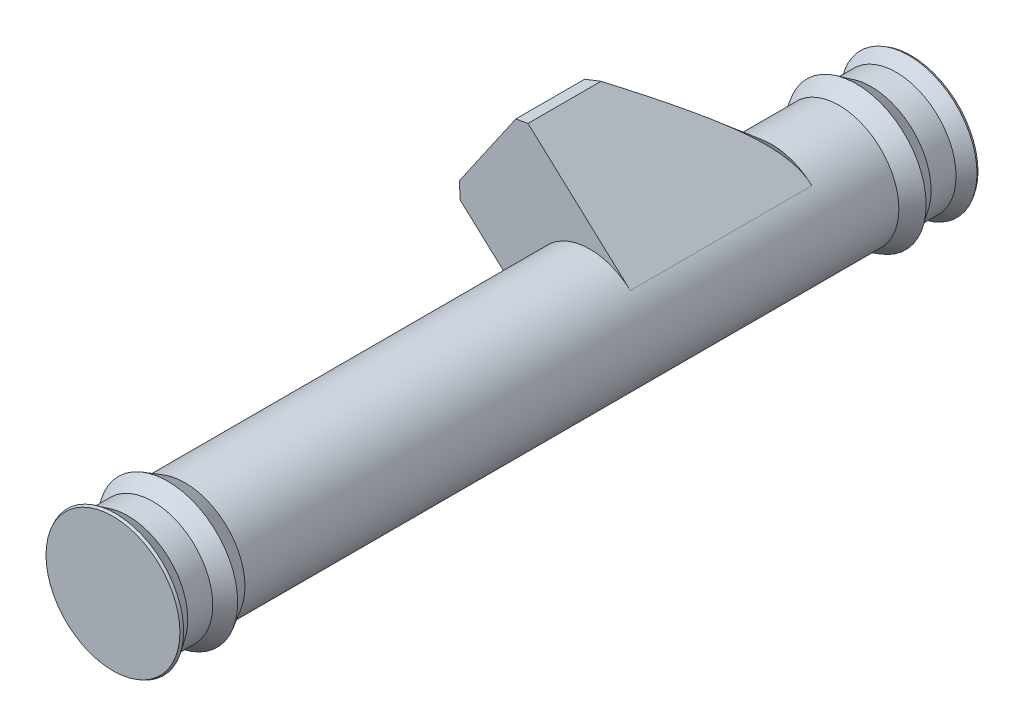
from build123d import *
from OCP.BRepFilletAPI import BRepFilletAPI_MakeChamfer

# Parameters (mm, degrees)
BOSS_EXTRUDE1_DEPTH      = 3
SKETCH4_R                = 6
BOSS_EXTRUDE2_DEPTH      = 40
BOSS_EXTRUDE3_DEPTH      = 4.7
BOSS_EXTRUDE3_DEPTH_BACK = 1.5
CHAMFER1_START           = -13.500000159
CHAMFER1_DEPTH           = 12.000000159
CHAMFER1_2_ANGLE         = 180
CUT_EXTRUDE1_DEPTH       = 3.4
SKETCH9_R                = 1.4
CUT_EXTRUDE2_DEPTH       = 27.5
SKETCH10_R               = 3.5
CUT_EXTRUDE3_DEPTH       = 23
CHAMFER2_SIZE            = 3
CHAMFER2_SIZE_2          = 2.517298894
CHAMFER3_SIZE            = 1
CHAMFER3_SIZE2           = 1.169832114
CHAMFER3_SIZE2_2         = 0.887609284
CHAMFER4_SIZE            = 1.732050808
CHAMFER4_SIZE_2          = 1
CHAMFER5_SIZE            = 0.3
CHAMFER5_SIZE2           = 0.289831366


with BuildPart() as part:
    # Sketch3 → Boss-Extrude1 (new body)
    with BuildSketch(Plane.XY):
        with BuildLine():
            ThreePointArc((-21.06925633, 1.560185503), (-21.702383426, -4.120337722), (-16.861546239, -7.159332517))
            Line((-16.861546239, -7.159332517), (-16.235942246, -7.122800897))
            ThreePointArc((-16.235942246, -7.122800897), (-14.247317716, -6.480760333), (-12.653836147, -5.128850538))
            ThreePointArc((-12.653836147, -5.128850538), (21.262556938, 11.81913919), (56.062735888, -3.230898045))
            ThreePointArc((56.062735888, -3.230898045), (59.548283557, -3.823314658), (60.140700171, -0.337766989))
            ThreePointArc((60.140700171, -0.337766989), (19.96998669, 19.192613792), (-21.06925633, 1.560185503))
        make_face()
        Polygon((-14.842971244, -1.436629161), (-14.495267888, -1.784332517), (-14.848821278, -2.137885908), (-14.637840313, -2.550832882), (-15.083092963, -2.778319315), (-15.00954079, -3.236171091), (-15.503211236, -3.315477399), (-15.574237606, -3.773727796), (-16.068337858, -3.697144889), (-16.277038544, -4.111248976), (-16.723538831, -3.886221213), (-17.049626765, -4.215925369), (-17.405124343, -3.864326917), (-17.816901648, -4.077581746), (-18.046839834, -3.633590269), (-18.504279068, -3.70966601), (-18.586306367, -3.21644038), (-19.04494145, -3.147941973), (-18.971084274, -2.65342694), (-19.386332882, -2.447012878), (-19.163770631, -1.999278532), (-19.495267888, -1.67501361), (-19.145635065, -1.317582653), (-19.361157273, -0.906987537), (-18.918440472, -0.674604591), (-18.997037466, -0.217591808), (-18.504271649, -0.132846012), (-18.438303288, 0.326159812), (-17.94338851, 0.255030612), (-17.73926735, 0.671411115), (-17.290312559, 0.451321143), (-16.967880508, 0.784601421), (-16.60852704, 0.436944858), (-16.199126599, 0.654727893), (-15.964305958, 0.213299227), (-15.507733522, 0.294415085), (-15.420271807, -0.197875935), (-14.960909199, -0.261312244), (-15.029308259, -0.756611718), (-14.611808522, -0.958433771), align=None, mode=Mode.SUBTRACT)
    extrude(amount=BOSS_EXTRUDE1_DEPTH)


with BuildPart() as body_2:
    # Sketch4 → Boss-Extrude2 (new, symmetric)
    with BuildSketch(Plane.XY.offset(12.5)):
        with Locations((58.101718029, -1.784332517)):
            Circle(SKETCH4_R)
    extrude(amount=BOSS_EXTRUDE2_DEPTH, both=True)

    # Sketch8 → Boss-Extrude3 (add, two sides: drawn at the far end of the back side and taken through both)
    with BuildSketch(Plane.XY.offset(-BOSS_EXTRUDE3_DEPTH_BACK)):
        with BuildLine():
            Line((62.151425867, 2.642841122), (51.244940369, 12.619427404))
            Line((51.244940369, 12.619427404), (44.360090975, 2.654069132))
            Line((44.360090975, 2.654069132), (54.052010192, -6.211506156))
            ThreePointArc((54.052010192, -6.211506156), (62.528891669, -5.834040354), (62.151425867, 2.642841122))
        make_face()
    extrude(amount=BOSS_EXTRUDE3_DEPTH + BOSS_EXTRUDE3_DEPTH_BACK)

    # Chamfer1: read off the stored shape, not the designer's step
    # Chamfer1 outline → Chamfer1 (add)
    with BuildSketch(Plane.XY.offset(CHAMFER1_START)):
        with BuildLine():
            Line((51.244940369, 12.619427404), (44.360090975, 2.654069132))
            Line((44.360090975, 2.654069132), (54.052010192, -6.211506156))
            ThreePointArc((54.052010192, -6.211506156), (53.67454439, 2.265375321), (62.151425867, 2.642841122))
            Line((62.151425867, 2.642841122), (51.244940369, 12.619427404))
        make_face()
    extrude(amount=CHAMFER1_DEPTH)

    # Chamfer1 2 outline → Chamfer1 2 (revolve, cut)
    with BuildSketch(Plane(origin=(58.101718029, -1.784332517, 0), x_dir=(0.6749513062060508, 0.7378622732263427, 0), z_dir=(0.7378622732263427, -0.6749513062060508, 0))):
        Polygon((15.952545244, -1.63901845), (5.999993338, -13.500007939), (15.952545243, -13.500000159), align=None)
    revolve(axis=Axis((58.101718029, -1.784332517, 0), (0, 0, 1)), revolution_arc=CHAMFER1_2_ANGLE, mode=Mode.SUBTRACT)

    # Sketch6 → Cut-Extrude1 (cut)
    with BuildSketch(Plane.XY):
        with BuildLine():
            Line((-16.85267585, -7.459325585), (-16.209835721, -7.421787475))
            ThreePointArc((-16.209835721, -7.421787475), (-14.1052834, -6.74504216), (-12.418987212, -5.315521311))
            ThreePointArc((-12.418987212, -5.315521311), (21.262849062, 11.519032134), (55.827922983, -3.418301943))
            ThreePointArc((55.827922983, -3.418301943), (59.733301775, -4.059840039), (60.378935523, -0.155136246))
            ThreePointArc((60.378935523, -0.155136246), (19.977496019, 19.492520208), (-21.298028536, 1.754487883))
            ThreePointArc((-21.298028536, 1.754487883), (-21.97276199, -4.250320867), (-16.85267585, -7.459325585))
        make_face()
    extrude(amount=CUT_EXTRUDE1_DEPTH, mode=Mode.SUBTRACT)

    # Sketch9 → Cut-Extrude2 (cut)
    with BuildSketch(Plane(origin=(0, 0, -27.5), x_dir=(-1, 0, 0), z_dir=(0, 0, -1))):
        with Locations((-58.101718029, -1.784332517)):
            Circle(SKETCH9_R)
    extrude(amount=-CUT_EXTRUDE2_DEPTH, mode=Mode.SUBTRACT)

    # Sketch10 → Cut-Extrude3 (cut)
    with BuildSketch(Plane(origin=(0, 0, -27.5), x_dir=(-1, 0, 0), z_dir=(0, 0, -1))):
        with Locations((-58.101718029, -1.784332517)):
            Circle(SKETCH10_R)
    extrude(amount=-CUT_EXTRUDE3_DEPTH, mode=Mode.SUBTRACT)

    # Chamfer2
    # the kernel refuses this chamfer: 3, 2.517298894 mm, written as the material it adds along each edge
    with BuildSketch(Plane(origin=(58.101718029, -1.784332517, -4.5), x_dir=(-1, 0, 0), z_dir=(0, -1, 0))) as chamfer2_piece_1_section:
        Polygon((3.5, CHAMFER2_SIZE), (3.5 - CHAMFER2_SIZE_2, 0), (3.5, 0), align=None)
    chamfer2_piece_1 = revolve(axis=Axis((58.101718029, -1.784332517, -4.5), (0, 0, -1)), mode=Mode.PRIVATE)
    chamfer2_piece_1 = chamfer2_piece_1 - Plane(origin=(58.101718029, -1.784332517, -4.5), x_dir=(-1, 0, 0), z_dir=(0, 0, -1)) * Cylinder(1.4, 14, mode=Mode.PRIVATE)
    add(chamfer2_piece_1)

    # Sketch11 → Revolve1 (revolve)
    with BuildSketch(Plane(origin=(58.101718029, 0, 0), x_dir=(0, 0, -1), z_dir=(1, 0, 0)), mode=Mode.PRIVATE) as revolve1_sk:
        Polygon((27.5, -7.784332517), (27.5, -8.784332517), (26, -7.784332517), align=None)
        Polygon((23.5, -7.784332517), (22, -8.784332517), (22, -7.784332517), align=None)
    revolve1 = revolve(revolve1_sk.sketch.rotate(Axis((58.101718029, -1.784332517, 52.5), (0, 0, -1)), 270), axis=Axis((58.101718029, -1.784332517, 52.5), (0, 0, -1)))

    # Mirror1: Revolve1 across plane
    add(revolve1.mirror(Plane.XY.offset(12.5)))

    # Chamfer3: one chamfer whose edges measure the first distance from different faces: ONE call of the kernel's chamfer builder (chamfer() names one face for all edges)
    chamfer3_edges_1 = [body_2.edges().sort_by_distance(p)[0] for p in [
        (44.360090975, 2.654069132, 1.6),
    ]]
    chamfer3_side_1 = [body_2.faces().sort_by_distance(p)[0] for p in [
        (49.206050583, -1.778718512, 1.6),
    ]]
    chamfer3_edges_2 = [body_2.edges().sort_by_distance(p)[0] for p in [
        (51.244940369, 12.619427404, 1.6),
    ]]
    chamfer3_side_2 = [body_2.faces().sort_by_distance(p)[0] for p in [
        (47.802515672, 7.636748268, 4.563930343),
    ]]
    chamfer3 = BRepFilletAPI_MakeChamfer(body_2.part.solid().wrapped)
    for e in chamfer3_edges_1:
        chamfer3.Add(CHAMFER3_SIZE, CHAMFER3_SIZE2, e.wrapped, chamfer3_side_1[0].wrapped)  # the first distance lies on this face
    for e in chamfer3_edges_2:
        chamfer3.Add(CHAMFER3_SIZE, CHAMFER3_SIZE2_2, e.wrapped, chamfer3_side_2[0].wrapped)  # the first distance lies on this face
    add(Compound.cast(chamfer3.Shape()), mode=Mode.REPLACE)

    # Chamfer4
    # the kernel refuses this chamfer: 1.732050808, 1 mm, written as the material it adds along each edge
    with BuildSketch(Plane(origin=(58.101718029, -1.784332517, -22), x_dir=(1, 0, 0), z_dir=(0, 1, 0))) as chamfer4_piece_1:
        Polygon((6, -CHAMFER4_SIZE), (6 + CHAMFER4_SIZE_2, 0), (6, 0), align=None)
    revolve(axis=Axis((58.101718029, -1.784332517, -22), (0, 0, -1)))
    with BuildSketch(Plane(origin=(58.101718029, -1.784332517, 47), x_dir=(1, 0, 0), z_dir=(0, 1, 0))) as chamfer4_piece_2:
        Polygon((6, CHAMFER4_SIZE), (6 + CHAMFER4_SIZE_2, 0), (6, 0), align=None)
    revolve(axis=Axis((58.101718029, -1.784332517, 47), (0, 0, -1)))

    # Chamfer5: one chamfer whose edges measure the first distance from different faces: ONE call of the kernel's chamfer builder (chamfer() names one face for all edges)
    chamfer5_edges_1 = [body_2.edges().sort_by_distance(p)[0] for p in [
        (51.101718029, -1.784332517, -27.5),
    ]]
    chamfer5_side_1 = [body_2.faces().sort_by_distance(p)[0] for p in [
        (61.799707928, -1.784332517, -27.5),
    ]]
    chamfer5_edges_2 = [body_2.edges().sort_by_distance(p)[0] for p in [
        (51.101718029, -1.784332517, 52.5),
    ]]
    chamfer5_side_2 = [body_2.faces().sort_by_distance(p)[0] for p in [
        (51.601718029, -1.784332517, 51.75),
    ]]
    chamfer5 = BRepFilletAPI_MakeChamfer(body_2.part.solid().wrapped)
    for e in chamfer5_edges_1:
        chamfer5.Add(CHAMFER5_SIZE, CHAMFER5_SIZE2, e.wrapped, chamfer5_side_1[0].wrapped)  # the first distance lies on this face
    for e in chamfer5_edges_2:
        chamfer5.Add(CHAMFER5_SIZE, CHAMFER5_SIZE2, e.wrapped, chamfer5_side_2[0].wrapped)  # the first distance lies on this face
    add(Compound.cast(chamfer5.Shape()), mode=Mode.REPLACE)


solid = body_2.part
